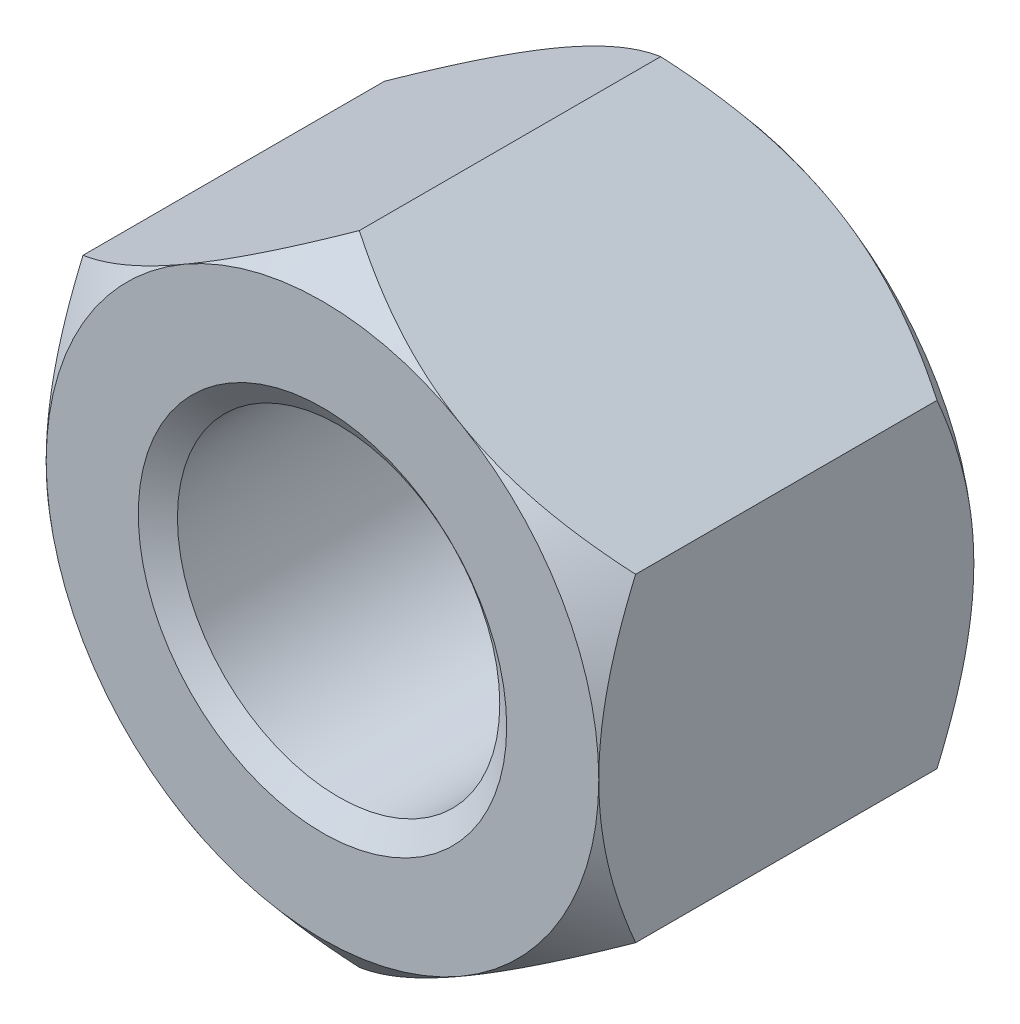
from build123d import *

# Parameters (mm, degrees)
THREADSCHEMATIC_START     = -25.8572
THREADSCHEMATIC_OUTLINE_R = 11.1125
THREADSCHEMATIC_DEPTH     = 25.8572


# Read off the part's stored shape, not the designer's step: ThreadSchematic
with BuildPart() as part:
    # ThreadSchematic outline → ThreadSchematic (new body)
    with BuildSketch(Plane.XY.offset(THREADSCHEMATIC_START)):
        Polygon((19.05, 10.998522628), (0, 21.997045256), (-19.05, 10.998522628), (-19.05, -10.998522628), (0, -21.997045256), (19.05, -10.998522628), align=None)
        Circle(THREADSCHEMATIC_OUTLINE_R, mode=Mode.SUBTRACT)
    extrude(amount=THREADSCHEMATIC_DEPTH)

    # Sketch3 → Double-Chamfer (revolve, cut)
    with BuildSketch(Plane(origin=(0, 0, 0), x_dir=(0, 0, -1), z_dir=(1, 0, 0))):
        Polygon((25.8572, 19.05), (23.3172, 21.997045256), (23.3172, 34.697045256), (38.5572, 34.697045256), (38.5572, 19.05), align=None)
        Polygon((2.54, 34.697045256), (-12.7, 34.697045256), (-12.7, 19.05), (0, 19.05), (2.54, 21.997045256), align=None)
    revolve(axis=Axis((0, 0, 0), (0, 0, -1)), mode=Mode.SUBTRACT)

    # EndChamferSke → EndChamfer (revolve, cut)
    with BuildSketch(Plane(origin=(0, 0, 0), x_dir=(0, 0, -1), z_dir=(1, 0, 0)), mode=Mode.PRIVATE) as endchamfer_sk:
        Polygon((25.8318, 12.7), (24.609062586, 10.95375), (25.8826, 10.95375), (25.8826, 12.7), align=None)
        Polygon((-0.0508, 12.7), (0, 12.7), (1.222737414, 10.95375), (-0.0508, 10.95375), align=None)
    revolve(endchamfer_sk.sketch.rotate(Axis((0, 0, -25.037505729), (0, 0, -1)), 90), axis=Axis((0, 0, -25.037505729), (0, 0, -1)), mode=Mode.SUBTRACT)


solid = part.part
